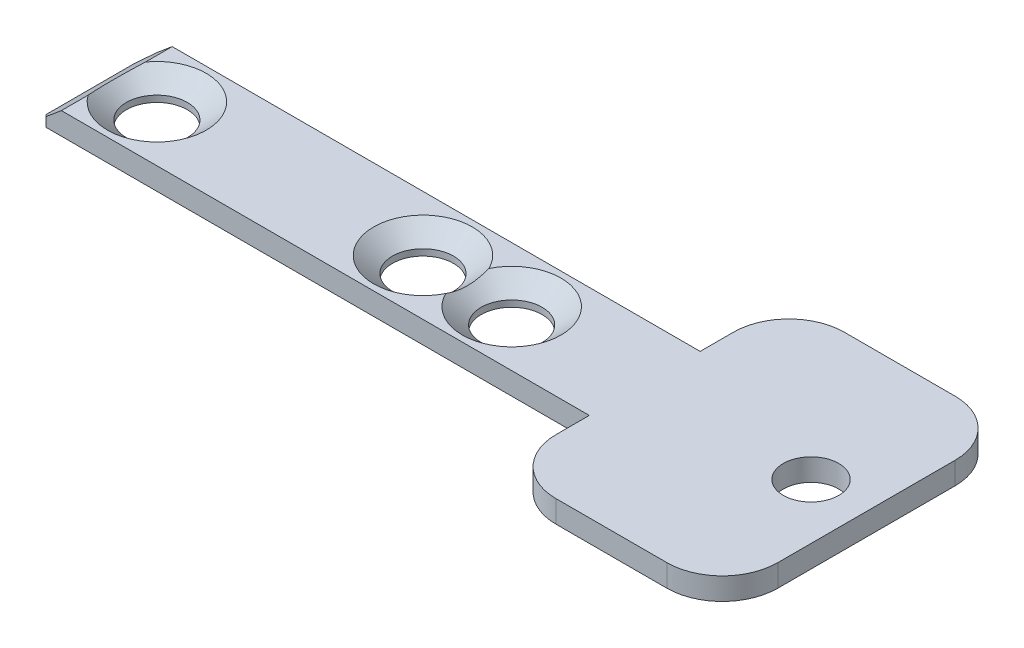
from build123d import *

# Parameters (mm, degrees)
BOSS_EXTRUDE1_DEPTH = 2
CHAMFER1_SIZE       = 1
FILLET1_R           = 5
SKETCH2_R           = 2.5
CUT_EXTRUDE1_DEPTH  = 3
SKETCH3_R           = 2.75
CUT_EXTRUDE2_DEPTH  = 3
CHAMFER2_SIZE2      = 2.383507185
CHAMFER2_SIZE       = 2
CHAMFER3_SIZE       = 1.7
CHAMFER3_SIZE_2     = 1.426469373


# Some blends are built 0.0001 mm under size
with BuildPart() as part:
    # Sketch1 → Boss-Extrude1 (new body)
    with BuildSketch(Plane(origin=(0, 0, 0), x_dir=(1, 0, 0), z_dir=(0, 1, 0))):
        Polygon((25, 5), (25, 13), (45, 13), (45, -13), (25, -13), (25, -5), (-25, -5), (-25, 5), align=None)
    extrude(amount=BOSS_EXTRUDE1_DEPTH)

    # Chamfer1
    chamfer1_edges = [part.edges().sort_by_distance(p)[0] for p in [
        (-25, 1, 5),
        (-25, 1, -5),
    ]]
    chamfer(chamfer1_edges, length=CHAMFER1_SIZE)

    # Fillet1
    fillet1_edges = [part.edges().sort_by_distance(p)[0] for p in [
        (25, 1, -13),
        (45, 1, -13),
        (45, 1, 13),
        (25, 1, 13),
    ]]
    fillet(fillet1_edges, radius=FILLET1_R)

    # Sketch2 → Cut-Extrude1 (cut)
    with BuildSketch(Plane(origin=(0, 2, 0), x_dir=(1, 0, 0), z_dir=(0, 1, 0))):
        with Locations(Location((40, 0, 0), (0, 0, 270))):
            Circle(SKETCH2_R)
    extrude(amount=-CUT_EXTRUDE1_DEPTH, mode=Mode.SUBTRACT)

    # Sketch3 → Cut-Extrude2 (cut)
    with BuildSketch(Plane(origin=(0, 2, 0), x_dir=(1, 0, 0), z_dir=(0, 1, 0))):
        with Locations(Location((13, 0, 0), (0, 0, 270))):
            Circle(SKETCH3_R)
        with Locations(Location((5, 0, 0), (0, 0, 270))):
            Circle(SKETCH3_R)
        with Locations(Location((-19, 0, 0), (0, 0, 270))):
            Circle(SKETCH3_R)
    extrude(amount=-CUT_EXTRUDE2_DEPTH, mode=Mode.SUBTRACT)

    # Chamfer2
    chamfer2_edges = [part.edges().sort_by_distance(p)[0] for p in [
        (-25, 2, 0),
    ]]
    chamfer2_side = [part.faces().sort_by_distance(p)[0] for p in [
        (-25, 1.96, 0),
    ]]
    chamfer(chamfer2_edges, length=CHAMFER2_SIZE - 0.0001, length2=CHAMFER2_SIZE2 - 0.0001, reference=chamfer2_side[0])  # a hair under: the kernel refuses the full size

    # Chamfer3
    # the kernel refuses this chamfer: 1.7, 1.426469373 mm, written as the material it takes off along each edge
    with BuildSketch(Plane(origin=(13, 2, 0), x_dir=(0, 0, 1), z_dir=(-1, 0, 0))) as chamfer3_piece_1:
        Polygon((2.75 + CHAMFER3_SIZE, 0), (2.75, -CHAMFER3_SIZE_2), (2.75, 0), align=None)
    revolve(axis=Axis((13, 2, 0), (0, 1, 0)), mode=Mode.SUBTRACT)
    with BuildSketch(Plane(origin=(5, 2, 0), x_dir=(0, 0, 1), z_dir=(-1, 0, 0))) as chamfer3_piece_2:
        Polygon((2.75 + CHAMFER3_SIZE, 0), (2.75, -CHAMFER3_SIZE_2), (2.75, 0), align=None)
    revolve(axis=Axis((5, 2, 0), (0, 1, 0)), mode=Mode.SUBTRACT)
    with BuildSketch(Plane(origin=(-19, 2, 0), x_dir=(0, 0, 1), z_dir=(-1, 0, 0))) as chamfer3_piece_3:
        Polygon((2.75 + CHAMFER3_SIZE, 0), (2.75, -CHAMFER3_SIZE_2), (2.75, 0), align=None)
    revolve(axis=Axis((-19, 2, 0), (0, 1, 0)), mode=Mode.SUBTRACT)


solid = part.part
